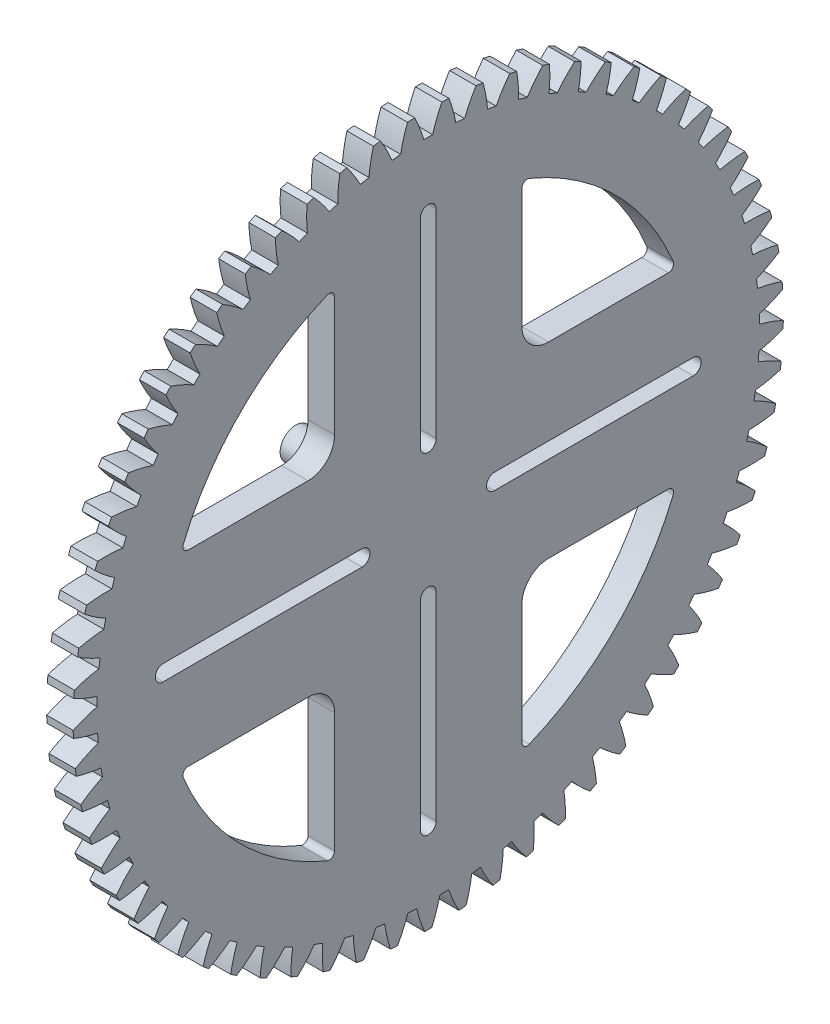
from build123d import *

# Parameters (mm, degrees)
BASPROSKE_W             = 10
BASPROSKE_H             = 134
TOOTHCUT_DEPTH          = 190.768279752
TEETHCUTS_COUNT         = 65
TEETHCUTS_ANGLE         = 354.461538462
HUBNEAONESKE_R          = 6
HUBNEARONE_DEPTH        = 40.0000508
BORSKE_R                = 4
BORE_DEPTH              = 50.0000508
ENL_V_MAT_EXTRU_1_DEPTH = 10
ENL_V_MAT_EXTRU_2_DEPTH = 5
CONG_1_R                = 10
CONG_2_R                = 2
ENL_V_MAT_EXTRU_3_DEPTH = 194.670907796
CONG_3_R                = 10
CONG_4_R                = 2
CONG_5_R                = 1
ESQUISSE5_R             = 11
ESQUISSE5_R_2           = 6
BOSS_EXTRU_1_DEPTH      = 17
CONG_6_SIZE             = 2
CONG_6_SIZE_2           = 10
BOSS_EXTRU_2_START      = -30
BOSS_EXTRU_2_DEPTH      = 30
BOSS_EXTRU_3_START      = 20.0000508
ESQUISSE7_R             = 4
BOSS_EXTRU_3_DEPTH      = 20.0000508
ENL_V_START             = -23
ESQUISSE8_R             = 6
ESQUISSE8_R_2           = 5.9
ENL_V_MAT_EXTRU_4_DEPTH = 23


with BuildPart() as part:
    # BasProSke → Base-Revolve (revolve)
    with BuildSketch(Plane(origin=(0, 0, 0), x_dir=(1, 0, 0), z_dir=(0, 1, 0)), mode=Mode.PRIVATE) as base_revolve_sk:
        with Locations((5, 67)):
            Rectangle(BASPROSKE_W, BASPROSKE_H)
    revolve(base_revolve_sk.sketch.rotate(Axis((-10, 0, 0), (1, 0, 0)), 180), axis=Axis((-10, 0, 0), (1, 0, 0)))

    # TooCutSke → ToothCut (cut, through all)
    with BuildSketch(Plane(origin=(0, 0, 0), x_dir=(0, 0, -1), z_dir=(1, 0, 0))):
        with BuildLine():
            ThreePointArc((1.667679112, 124.987874801), (0, 124.999), (-1.667679112, 124.987874801))
            ThreePointArc((-1.667679112, 124.987874801), (-3.198590853, 129.537570146), (-5.142534786, 133.926704511))
            ThreePointArc((-5.142534786, 133.926704511), (0, 134.0254), (5.142534786, 133.926704511))
            ThreePointArc((5.142534786, 133.926704511), (3.198590853, 129.537570146), (1.667679112, 124.987874801))
        make_face()
    toothcut = extrude(amount=TOOTHCUT_DEPTH, mode=Mode.SUBTRACT)

    # TeethCuts: ToothCut ×65 about axis
    teethcuts_axis = Axis((-10, 0, 0), (1, 0, 0))
    for i in range(1, TEETHCUTS_COUNT):
        add(toothcut.rotate(teethcuts_axis, i * TEETHCUTS_ANGLE / (TEETHCUTS_COUNT - 1)), mode=Mode.SUBTRACT)

    # HubNeaOneSke → HubNearOne (add)
    with BuildSketch(Plane.ZY):
        with Locations(Location((0, 0, 0), (0, 0, 180))):
            Circle(HUBNEAONESKE_R)
    extrude(amount=HUBNEARONE_DEPTH)

    # BorSke → Bore (cut, symmetric)
    with BuildSketch(Plane(origin=(0, 0, 0), x_dir=(0, 0, -1), z_dir=(1, 0, 0))):
        with Locations(Location((0, 0, 0), (0, 0, 180))):
            Circle(BORSKE_R)
    extrude(amount=BORE_DEPTH, both=True, mode=Mode.SUBTRACT)

    # Esquisse1 → Enlèv. mat.-Extru.1 (cut)
    with BuildSketch(Plane(origin=(10, 0, 0), x_dir=(0, 0, -1), z_dir=(1, 0, 0))):
        with BuildLine():
            Line((3, 100), (3, 25))
            Line((3, 25), (-3, 25))
            Line((-3, 25), (-3, 100))
            ThreePointArc((-3, 100), (0, 103), (3, 100))
        make_face()
        with BuildLine():
            Line((-3, 25), (3, 25))
            ThreePointArc((3, 25), (0, 22), (-3, 25))
        make_face()
        with BuildLine():
            Line((100, 3), (25, 3))
            ThreePointArc((25, 3), (22, 0), (25, -3))
            Line((25, -3), (100, -3))
            ThreePointArc((100, -3), (103, 0), (100, 3))
        make_face()
        with BuildLine():
            Line((-100, -3), (-25, -3))
            ThreePointArc((-25, -3), (-22, 0), (-25, 3))
            Line((-25, 3), (-100, 3))
            ThreePointArc((-100, 3), (-103, 0), (-100, -3))
        make_face()
        with BuildLine():
            Line((3, -100), (3, -25))
            ThreePointArc((3, -25), (0, -22), (-3, -25))
            Line((-3, -25), (-3, -100))
            ThreePointArc((-3, -100), (0, -103), (3, -100))
        make_face()
    extrude(amount=-ENL_V_MAT_EXTRU_1_DEPTH, mode=Mode.SUBTRACT)

    # Esquisse3 → Enlèv. mat.-Extru.2 (cut)
    with BuildSketch(Plane.ZY):
        Polygon((-113, -8), (-113, -18), (-18, -18), (-18, -113), (-8, -113), (-8, -12), (-12, -12), (-12, -8), align=None)
        Polygon((-113, 8), (-12, 8), (-12, 12), (-8, 12), (-8, 113), (-18, 113), (-18, 18), (-113, 18), align=None)
        Polygon((8, 113), (8, 12), (12, 12), (12, 8), (113, 8), (113, 18), (18, 18), (18, 113), align=None)
        Polygon((113, -8), (12, -8), (12, -12), (8, -12), (8, -113), (18, -113), (18, -18), (113, -18), align=None)
    extrude(amount=-ENL_V_MAT_EXTRU_2_DEPTH, mode=Mode.SUBTRACT)

    # Congé1
    # the kernel refuses this fillet: 10 mm, written as the material it takes off along each edge
    with BuildSketch(Plane(origin=(-25, -18, -18), x_dir=(0, 0, -1), z_dir=(1, 0, 0)), Plane(origin=(-25, 18, -18), x_dir=(0, 1, 0), z_dir=(1, 0, 0)), Plane(origin=(-25, 18, 18), x_dir=(0, 0, 1), z_dir=(1, 0, 0)), Plane(origin=(-25, -18, 18), x_dir=(0, -1, 0), z_dir=(1, 0, 0))) as cong_1_piece_1:
        with BuildLine():
            CenterArc((CONG_1_R, -CONG_1_R), CONG_1_R, 90, 90)
            Line((0, -CONG_1_R), (0, 0))
            Line((0, 0), (CONG_1_R, 0))
        make_face()
    extrude(amount=30, mode=Mode.SUBTRACT)
    with BuildSketch(Plane(origin=(-10, -12, 12), x_dir=(0, 1, 0), z_dir=(1, 0, 0)), Plane(origin=(-10, -12, -12), x_dir=(0, 0, 1), z_dir=(1, 0, 0)), Plane(origin=(-10, 12, 12), x_dir=(0, 0, -1), z_dir=(1, 0, 0)), Plane(origin=(-10, 12, -12), x_dir=(0, -1, 0), z_dir=(1, 0, 0))) as cong_1_piece_2:
        with BuildLine():
            CenterArc((8.782329983, -8.782329983), CONG_1_R, 118.570059811, 32.859880379)
            Line((0, -4), (0, 0))
            Line((0, 0), (4, 0))
        make_face()
    extrude(amount=15, mode=Mode.SUBTRACT)

    # Congé2
    cong_2_edges = [part.edges().sort_by_distance(p)[0] for p in [
        (2.5, 18, 113),
        (2.5, 8, 113),
        (2.5, 113, 8),
        (2.5, 113, 18),
        (2.5, 8, -113),
        (2.5, 18, -113),
        (2.5, 113, -18),
        (2.5, 113, -8),
        (2.5, -8, -113),
        (2.5, -113, -8),
        (2.5, -113, -18),
        (2.5, -18, -113),
        (2.5, -113, 18),
        (2.5, -113, 8),
        (2.5, -8, 113),
        (2.5, -18, 113),
    ]]
    fillet(cong_2_edges, radius=CONG_2_R)

    # Esquisse4 → Enlèv. mat.-Extru.3 (cut, through all)
    with BuildSketch(Plane.ZY):
        with BuildLine():
            Line((-93.541434669, 35.355339059), (-35.355339059, 35.355339059))
            Line((-35.355339059, 35.355339059), (-35.355339059, 93.541434669))
            ThreePointArc((-35.355339059, 93.541434669), (-70.710678119, 70.710678119), (-93.541434669, 35.355339059))
        make_face()
        with BuildLine():
            Line((35.355339059, 93.541434669), (35.355339059, 35.355339059))
            Line((35.355339059, 35.355339059), (93.541434669, 35.355339059))
            ThreePointArc((93.541434669, 35.355339059), (70.710678119, 70.710678119), (35.355339059, 93.541434669))
        make_face()
        with BuildLine():
            Line((93.541434669, -35.355339059), (35.355339059, -35.355339059))
            Line((35.355339059, -35.355339059), (35.355339059, -93.541434669))
            ThreePointArc((35.355339059, -93.541434669), (70.710678119, -70.710678119), (93.541434669, -35.355339059))
        make_face()
        with BuildLine():
            Line((-35.355339059, -93.541434669), (-35.355339059, -35.355339059))
            Line((-35.355339059, -35.355339059), (-93.541434669, -35.355339059))
            ThreePointArc((-93.541434669, -35.355339059), (-70.710678119, -70.710678119), (-35.355339059, -93.541434669))
        make_face()
    extrude(amount=-ENL_V_MAT_EXTRU_3_DEPTH, mode=Mode.SUBTRACT)

    # Congé3
    cong_3_edges = [part.edges().sort_by_distance(p)[0] for p in [
        (5, 35.355339059, -35.355339059),
        (5, 35.355339059, 35.355339059),
        (5, -35.355339059, 35.355339059),
        (5, -35.355339059, -35.355339059),
    ]]
    fillet(cong_3_edges, radius=CONG_3_R)

    # Congé4
    cong_4_edges = [part.edges().sort_by_distance(p)[0] for p in [
        (5, 35.355339059, -93.541434669),
        (5, 93.541434669, -35.355339059),
        (5, 93.541434669, 35.355339059),
        (5, 35.355339059, 93.541434669),
        (5, -35.355339059, 93.541434669),
        (5, -93.541434669, 35.355339059),
        (5, -93.541434669, -35.355339059),
        (5, -35.355339059, -93.541434669),
    ]]
    fillet(cong_4_edges, radius=CONG_4_R)

    # Congé5
    # the kernel refuses this fillet: 1 mm, written as the material it takes off along each edge
    with BuildSketch(Plane(origin=(0, 8, 9.5), x_dir=(0, -1, 0), z_dir=(0, 0, 1))) as cong_5_piece_1_section:
        with BuildLine():
            CenterArc((CONG_5_R, CONG_5_R), CONG_5_R, 180, 90)
            Line((0, CONG_5_R), (0, 0))
            Line((0, 0), (CONG_5_R, 0))
        make_face()
    cong_5_piece_1 = extrude(amount=101.5, mode=Mode.PRIVATE)
    cong_5_piece_1 = cong_5_piece_1 - Plane(origin=(0, 3.217670017, 3.217670017), x_dir=(0, 0, -1), z_dir=(-1, 0, 0)) * Cylinder(10, 208, mode=Mode.PRIVATE)
    with BuildSketch(Plane(origin=(0, 9.5, -8), x_dir=(0, 0, 1), z_dir=(0, 1, 0))) as cong_5_piece_2_section:
        with BuildLine():
            CenterArc((CONG_5_R, CONG_5_R), CONG_5_R, 180, 90)
            Line((0, CONG_5_R), (0, 0))
            Line((0, 0), (CONG_5_R, 0))
        make_face()
    cong_5_piece_2 = extrude(amount=101.5, mode=Mode.PRIVATE)
    cong_5_piece_2 = cong_5_piece_2 - Plane(origin=(0, 3.217670017, -3.217670017), x_dir=(0, -1, 0), z_dir=(-1, 0, 0)) * Cylinder(10, 207, mode=Mode.PRIVATE)
    with BuildSketch(Plane(origin=(0, -8, -9.5), x_dir=(0, 1, 0), z_dir=(0, 0, -1))) as cong_5_piece_3_section:
        with BuildLine():
            CenterArc((CONG_5_R, CONG_5_R), CONG_5_R, 180, 90)
            Line((0, CONG_5_R), (0, 0))
            Line((0, 0), (CONG_5_R, 0))
        make_face()
    cong_5_piece_3 = extrude(amount=101.5, mode=Mode.PRIVATE)
    cong_5_piece_3 = cong_5_piece_3 - Plane(origin=(0, -3.217670017, -3.217670017), x_dir=(0, 0, 1), z_dir=(-1, 0, 0)) * Cylinder(10, 207, mode=Mode.PRIVATE)
    with BuildSketch(Plane(origin=(0, -9.5, 8), x_dir=(0, 0, -1), z_dir=(0, -1, 0))) as cong_5_piece_4_section:
        with BuildLine():
            CenterArc((CONG_5_R, CONG_5_R), CONG_5_R, 180, 90)
            Line((0, CONG_5_R), (0, 0))
            Line((0, 0), (CONG_5_R, 0))
        make_face()
    cong_5_piece_4 = extrude(amount=101.5, mode=Mode.PRIVATE)
    cong_5_piece_4 = cong_5_piece_4 - Plane(origin=(0, -3.217670017, 3.217670017), x_dir=(0, 1, 0), z_dir=(-1, 0, 0)) * Cylinder(10, 207, mode=Mode.PRIVATE)
    with BuildSketch(Plane(origin=(0, -28, -18), x_dir=(0, 0, -1), z_dir=(0, -1, 0)), Plane(origin=(0, 18, -28), x_dir=(0, 1, 0), z_dir=(0, 0, -1)), Plane(origin=(0, -18, 28), x_dir=(0, -1, 0), z_dir=(0, 0, 1)), Plane(origin=(0, 28, 18), x_dir=(0, 0, 1), z_dir=(0, 1, 0)), Plane(origin=(0, 111, -18), x_dir=(0, 0, -1), z_dir=(0, -1, 0)), Plane(origin=(0, 18, 111), x_dir=(0, 1, 0), z_dir=(0, 0, -1)), Plane(origin=(0, -111, 18), x_dir=(0, 0, 1), z_dir=(0, 1, 0)), Plane(origin=(0, -18, -111), x_dir=(0, -1, 0), z_dir=(0, 0, 1))) as cong_5_piece_5:
        with BuildLine():
            CenterArc((CONG_5_R, CONG_5_R), CONG_5_R, 180, 90)
            Line((0, CONG_5_R), (0, 0))
            Line((0, 0), (CONG_5_R, 0))
        make_face()
    cong_5_piece_5_solid = extrude(amount=83, mode=Mode.PRIVATE)
    with BuildSketch(Plane(origin=(0, 3.217670017, -3.217670017), x_dir=(0, 0.9692508920434058, -0.24607459900010414), z_dir=(0, 0.24607459900010414, 0.9692508920434058))) as cong_5_piece_6_section:
        with BuildLine():
            CenterArc((10 - CONG_5_R, -CONG_5_R), CONG_5_R, 0, 90)
            Line((10, -CONG_5_R), (10, 0))
            Line((10, 0), (10 - CONG_5_R, 0))
        make_face()
    cong_5_piece_6 = revolve(axis=Axis((0, 3.217670017, -3.217670017), (-1, 0, 0)), revolution_arc=61.509303849, mode=Mode.PRIVATE)
    cong_5_piece_6 = split(cong_5_piece_6, bisect_by=Plane(origin=(0, 8, -3.217670017), z_dir=(0, 1, 0)), keep=Keep.TOP, mode=Mode.PRIVATE)
    cong_5_piece_6 = split(cong_5_piece_6, bisect_by=Plane(origin=(0, 3.217670017, -8), z_dir=(0, 0, -1)), keep=Keep.TOP, mode=Mode.PRIVATE)
    with BuildSketch(Plane(origin=(0, 3.217670017, 3.217670017), x_dir=(0, 0.24607459900010414, 0.9692508920434058), z_dir=(0, -0.9692508920434058, 0.24607459900010414))) as cong_5_piece_7_section:
        with BuildLine():
            CenterArc((10 - CONG_5_R, -CONG_5_R), CONG_5_R, 0, 90)
            Line((10, -CONG_5_R), (10, 0))
            Line((10, 0), (10 - CONG_5_R, 0))
        make_face()
    cong_5_piece_7 = revolve(axis=Axis((0, 3.217670017, 3.217670017), (-1, 0, 0)), revolution_arc=61.509303849, mode=Mode.PRIVATE)
    cong_5_piece_7 = split(cong_5_piece_7, bisect_by=Plane(origin=(0, 3.217670017, 8), z_dir=(0, 0, 1)), keep=Keep.TOP, mode=Mode.PRIVATE)
    cong_5_piece_7 = split(cong_5_piece_7, bisect_by=Plane(origin=(0, 8, 3.217670017), z_dir=(0, 1, 0)), keep=Keep.TOP, mode=Mode.PRIVATE)
    with BuildSketch(Plane(origin=(0, -3.217670017, -3.217670017), x_dir=(0, -0.24607459900010414, -0.9692508920434058), z_dir=(0, 0.9692508920434058, -0.24607459900010414))) as cong_5_piece_8_section:
        with BuildLine():
            CenterArc((10 - CONG_5_R, -CONG_5_R), CONG_5_R, 0, 90)
            Line((10, -CONG_5_R), (10, 0))
            Line((10, 0), (10 - CONG_5_R, 0))
        make_face()
    cong_5_piece_8 = revolve(axis=Axis((0, -3.217670017, -3.217670017), (-1, 0, 0)), revolution_arc=61.509303849, mode=Mode.PRIVATE)
    cong_5_piece_8 = split(cong_5_piece_8, bisect_by=Plane(origin=(0, -8, -3.217670017), z_dir=(0, -1, 0)), keep=Keep.TOP, mode=Mode.PRIVATE)
    cong_5_piece_8 = split(cong_5_piece_8, bisect_by=Plane(origin=(0, -3.217670017, -8), z_dir=(0, 0, -1)), keep=Keep.TOP, mode=Mode.PRIVATE)
    with BuildSketch(Plane(origin=(0, -3.217670017, 3.217670017), x_dir=(0, -0.9692508920434058, 0.24607459900010414), z_dir=(0, -0.24607459900010414, -0.9692508920434058))) as cong_5_piece_9_section:
        with BuildLine():
            CenterArc((10 - CONG_5_R, -CONG_5_R), CONG_5_R, 0, 90)
            Line((10, -CONG_5_R), (10, 0))
            Line((10, 0), (10 - CONG_5_R, 0))
        make_face()
    cong_5_piece_9 = revolve(axis=Axis((0, -3.217670017, 3.217670017), (-1, 0, 0)), revolution_arc=61.509303849, mode=Mode.PRIVATE)
    cong_5_piece_9 = split(cong_5_piece_9, bisect_by=Plane(origin=(0, -8, 3.217670017), z_dir=(0, -1, 0)), keep=Keep.TOP, mode=Mode.PRIVATE)
    cong_5_piece_9 = split(cong_5_piece_9, bisect_by=Plane(origin=(0, -3.217670017, 8), z_dir=(0, 0, 1)), keep=Keep.TOP, mode=Mode.PRIVATE)
    with BuildSketch(Plane(origin=(0, -28, 28), x_dir=(0, 1, 0), z_dir=(0, 0, 1))) as cong_5_piece_10:
        with BuildLine():
            CenterArc((10 - CONG_5_R, -CONG_5_R), CONG_5_R, 0, 90)
            Line((10, -CONG_5_R), (10, 0))
            Line((10, 0), (10 - CONG_5_R, 0))
        make_face()
    cong_5_piece_10_solid = revolve(axis=Axis((0, -28, 28), (-1, 0, 0)), revolution_arc=90, mode=Mode.PRIVATE)
    with BuildSketch(Plane(origin=(0, 28, 28), x_dir=(0, 0, -1), z_dir=(0, 1, 0))) as cong_5_piece_11:
        with BuildLine():
            CenterArc((10 - CONG_5_R, -CONG_5_R), CONG_5_R, 0, 90)
            Line((10, -CONG_5_R), (10, 0))
            Line((10, 0), (10 - CONG_5_R, 0))
        make_face()
    cong_5_piece_11_solid = revolve(axis=Axis((0, 28, 28), (-1, 0, 0)), revolution_arc=90, mode=Mode.PRIVATE)
    with BuildSketch(Plane(origin=(0, 28, -28), x_dir=(0, -1, 0), z_dir=(0, 0, -1))) as cong_5_piece_12:
        with BuildLine():
            CenterArc((10 - CONG_5_R, -CONG_5_R), CONG_5_R, 0, 90)
            Line((10, -CONG_5_R), (10, 0))
            Line((10, 0), (10 - CONG_5_R, 0))
        make_face()
    cong_5_piece_12_solid = revolve(axis=Axis((0, 28, -28), (-1, 0, 0)), revolution_arc=90, mode=Mode.PRIVATE)
    with BuildSketch(Plane(origin=(0, -28, -28), x_dir=(0, 0, 1), z_dir=(0, -1, 0))) as cong_5_piece_13:
        with BuildLine():
            CenterArc((10 - CONG_5_R, -CONG_5_R), CONG_5_R, 0, 90)
            Line((10, -CONG_5_R), (10, 0))
            Line((10, 0), (10 - CONG_5_R, 0))
        make_face()
    cong_5_piece_13_solid = revolve(axis=Axis((0, -28, -28), (-1, 0, 0)), revolution_arc=90, mode=Mode.PRIVATE)
    with BuildSketch(Plane(origin=(0, 113, -10), x_dir=(0, 1, 0), z_dir=(0, 0, -1)), Plane(origin=(0, 113, 16), x_dir=(0, 1, 0), z_dir=(0, 0, -1)), Plane(origin=(0, 10, 113), x_dir=(0, 0, 1), z_dir=(0, 1, 0)), Plane(origin=(0, -16, 113), x_dir=(0, 0, 1), z_dir=(0, 1, 0)), Plane(origin=(0, -113, 10), x_dir=(0, -1, 0), z_dir=(0, 0, 1)), Plane(origin=(0, -113, -16), x_dir=(0, -1, 0), z_dir=(0, 0, 1)), Plane(origin=(0, -10, -113), x_dir=(0, 0, -1), z_dir=(0, -1, 0)), Plane(origin=(0, 16, -113), x_dir=(0, 0, -1), z_dir=(0, -1, 0))) as cong_5_piece_14:
        with BuildLine():
            CenterArc((CONG_5_R, CONG_5_R), CONG_5_R, 180, 90)
            Line((0, CONG_5_R), (0, 0))
            Line((0, 0), (CONG_5_R, 0))
        make_face()
    cong_5_piece_14_solid = extrude(amount=6, mode=Mode.PRIVATE)
    with BuildSketch(Plane(origin=(0, 111, 8), x_dir=(0, 0, -1), z_dir=(0, -1, 0))) as cong_5_piece_15_section:
        with BuildLine():
            CenterArc((CONG_5_R, CONG_5_R), CONG_5_R, 180, 90)
            Line((0, CONG_5_R), (0, 0))
            Line((0, 0), (CONG_5_R, 0))
        make_face()
    cong_5_piece_15 = extrude(amount=101.5, mode=Mode.PRIVATE)
    cong_5_piece_15 = cong_5_piece_15 - Plane(origin=(0, 3.217670017, 3.217670017), x_dir=(0, 0, -1), z_dir=(-1, 0, 0)) * Cylinder(10, 207, mode=Mode.PRIVATE)
    with BuildSketch(Plane(origin=(0, -8, 111), x_dir=(0, 1, 0), z_dir=(0, 0, -1))) as cong_5_piece_16_section:
        with BuildLine():
            CenterArc((CONG_5_R, CONG_5_R), CONG_5_R, 180, 90)
            Line((0, CONG_5_R), (0, 0))
            Line((0, 0), (CONG_5_R, 0))
        make_face()
    cong_5_piece_16 = extrude(amount=101.5, mode=Mode.PRIVATE)
    cong_5_piece_16 = cong_5_piece_16 - Plane(origin=(0, -3.217670017, 3.217670017), x_dir=(0, 1, 0), z_dir=(-1, 0, 0)) * Cylinder(10, 207, mode=Mode.PRIVATE)
    with BuildSketch(Plane(origin=(0, -111, -8), x_dir=(0, 0, 1), z_dir=(0, 1, 0))) as cong_5_piece_17_section:
        with BuildLine():
            CenterArc((CONG_5_R, CONG_5_R), CONG_5_R, 180, 90)
            Line((0, CONG_5_R), (0, 0))
            Line((0, 0), (CONG_5_R, 0))
        make_face()
    cong_5_piece_17 = extrude(amount=101.5, mode=Mode.PRIVATE)
    cong_5_piece_17 = cong_5_piece_17 - Plane(origin=(0, -3.217670017, -3.217670017), x_dir=(0, 0, 1), z_dir=(-1, 0, 0)) * Cylinder(10, 207, mode=Mode.PRIVATE)
    with BuildSketch(Plane(origin=(0, 8, -111), x_dir=(0, -1, 0), z_dir=(0, 0, 1))) as cong_5_piece_18_section:
        with BuildLine():
            CenterArc((CONG_5_R, CONG_5_R), CONG_5_R, 180, 90)
            Line((0, CONG_5_R), (0, 0))
            Line((0, 0), (CONG_5_R, 0))
        make_face()
    cong_5_piece_18 = extrude(amount=101.5, mode=Mode.PRIVATE)
    cong_5_piece_18 = cong_5_piece_18 - Plane(origin=(0, 3.217670017, -3.217670017), x_dir=(0, -1, 0), z_dir=(-1, 0, 0)) * Cylinder(10, 207, mode=Mode.PRIVATE)
    with BuildSketch(Plane(origin=(0, 111, -16), x_dir=(0, 1, 0), z_dir=(0, 0, 1))) as cong_5_piece_19:
        with BuildLine():
            CenterArc((2 + CONG_5_R, -CONG_5_R), CONG_5_R, 90, 90)
            Line((2, -CONG_5_R), (2, 0))
            Line((2, 0), (2 + CONG_5_R, 0))
        make_face()
    cong_5_piece_19_solid = revolve(axis=Axis((0, 111, -16), (-1, 0, 0)), revolution_arc=90, mode=Mode.PRIVATE)
    with BuildSketch(Plane(origin=(0, 111, -10), x_dir=(0, 0, 1), z_dir=(0, -1, 0))) as cong_5_piece_20:
        with BuildLine():
            CenterArc((2 + CONG_5_R, -CONG_5_R), CONG_5_R, 90, 90)
            Line((2, -CONG_5_R), (2, 0))
            Line((2, 0), (2 + CONG_5_R, 0))
        make_face()
    cong_5_piece_20_solid = revolve(axis=Axis((0, 111, -10), (-1, 0, 0)), revolution_arc=90, mode=Mode.PRIVATE)
    with BuildSketch(Plane(origin=(0, 111, 10), x_dir=(0, 0, -1), z_dir=(0, -1, 0))) as cong_5_piece_21:
        with BuildLine():
            CenterArc((2 + CONG_5_R, CONG_5_R), CONG_5_R, 180, 90)
            Line((2, CONG_5_R), (2, 0))
            Line((2, 0), (2 + CONG_5_R, 0))
        make_face()
    cong_5_piece_21_solid = revolve(axis=Axis((0, 111, 10), (1, 0, 0)), revolution_arc=90, mode=Mode.PRIVATE)
    with BuildSketch(Plane(origin=(0, 111, 16), x_dir=(0, 0, 1), z_dir=(0, -1, 0))) as cong_5_piece_22:
        with BuildLine():
            CenterArc((2 + CONG_5_R, -CONG_5_R), CONG_5_R, 90, 90)
            Line((2, -CONG_5_R), (2, 0))
            Line((2, 0), (2 + CONG_5_R, 0))
        make_face()
    cong_5_piece_22_solid = revolve(axis=Axis((0, 111, 16), (-1, 0, 0)), revolution_arc=90, mode=Mode.PRIVATE)
    with BuildSketch(Plane(origin=(0, 16, 111), x_dir=(0, 0, 1), z_dir=(0, -1, 0))) as cong_5_piece_23:
        with BuildLine():
            CenterArc((2 + CONG_5_R, -CONG_5_R), CONG_5_R, 90, 90)
            Line((2, -CONG_5_R), (2, 0))
            Line((2, 0), (2 + CONG_5_R, 0))
        make_face()
    cong_5_piece_23_solid = revolve(axis=Axis((0, 16, 111), (-1, 0, 0)), revolution_arc=90, mode=Mode.PRIVATE)
    with BuildSketch(Plane(origin=(0, 10, 111), x_dir=(0, -1, 0), z_dir=(0, 0, -1))) as cong_5_piece_24:
        with BuildLine():
            CenterArc((2 + CONG_5_R, -CONG_5_R), CONG_5_R, 90, 90)
            Line((2, -CONG_5_R), (2, 0))
            Line((2, 0), (2 + CONG_5_R, 0))
        make_face()
    cong_5_piece_24_solid = revolve(axis=Axis((0, 10, 111), (-1, 0, 0)), revolution_arc=90, mode=Mode.PRIVATE)
    with BuildSketch(Plane(origin=(0, -10, 111), x_dir=(0, 1, 0), z_dir=(0, 0, -1))) as cong_5_piece_25:
        with BuildLine():
            CenterArc((2 + CONG_5_R, CONG_5_R), CONG_5_R, 180, 90)
            Line((2, CONG_5_R), (2, 0))
            Line((2, 0), (2 + CONG_5_R, 0))
        make_face()
    cong_5_piece_25_solid = revolve(axis=Axis((0, -10, 111), (1, 0, 0)), revolution_arc=90, mode=Mode.PRIVATE)
    with BuildSketch(Plane(origin=(0, -16, 111), x_dir=(0, -1, 0), z_dir=(0, 0, -1))) as cong_5_piece_26:
        with BuildLine():
            CenterArc((2 + CONG_5_R, -CONG_5_R), CONG_5_R, 90, 90)
            Line((2, -CONG_5_R), (2, 0))
            Line((2, 0), (2 + CONG_5_R, 0))
        make_face()
    cong_5_piece_26_solid = revolve(axis=Axis((0, -16, 111), (-1, 0, 0)), revolution_arc=90, mode=Mode.PRIVATE)
    with BuildSketch(Plane(origin=(0, -111, 16), x_dir=(0, -1, 0), z_dir=(0, 0, -1))) as cong_5_piece_27:
        with BuildLine():
            CenterArc((2 + CONG_5_R, -CONG_5_R), CONG_5_R, 90, 90)
            Line((2, -CONG_5_R), (2, 0))
            Line((2, 0), (2 + CONG_5_R, 0))
        make_face()
    cong_5_piece_27_solid = revolve(axis=Axis((0, -111, 16), (-1, 0, 0)), revolution_arc=90, mode=Mode.PRIVATE)
    with BuildSketch(Plane(origin=(0, -111, 10), x_dir=(0, 0, -1), z_dir=(0, 1, 0))) as cong_5_piece_28:
        with BuildLine():
            CenterArc((2 + CONG_5_R, -CONG_5_R), CONG_5_R, 90, 90)
            Line((2, -CONG_5_R), (2, 0))
            Line((2, 0), (2 + CONG_5_R, 0))
        make_face()
    cong_5_piece_28_solid = revolve(axis=Axis((0, -111, 10), (-1, 0, 0)), revolution_arc=90, mode=Mode.PRIVATE)
    with BuildSketch(Plane(origin=(0, -111, -10), x_dir=(0, -1, 0), z_dir=(0, 0, -1))) as cong_5_piece_29:
        with BuildLine():
            CenterArc((2 + CONG_5_R, -CONG_5_R), CONG_5_R, 90, 90)
            Line((2, -CONG_5_R), (2, 0))
            Line((2, 0), (2 + CONG_5_R, 0))
        make_face()
    cong_5_piece_29_solid = revolve(axis=Axis((0, -111, -10), (-1, 0, 0)), revolution_arc=90, mode=Mode.PRIVATE)
    with BuildSketch(Plane(origin=(0, -111, -16), x_dir=(0, 0, -1), z_dir=(0, 1, 0))) as cong_5_piece_30:
        with BuildLine():
            CenterArc((2 + CONG_5_R, -CONG_5_R), CONG_5_R, 90, 90)
            Line((2, -CONG_5_R), (2, 0))
            Line((2, 0), (2 + CONG_5_R, 0))
        make_face()
    cong_5_piece_30_solid = revolve(axis=Axis((0, -111, -16), (-1, 0, 0)), revolution_arc=90, mode=Mode.PRIVATE)
    with BuildSketch(Plane(origin=(0, -16, -111), x_dir=(0, 0, -1), z_dir=(0, 1, 0))) as cong_5_piece_31:
        with BuildLine():
            CenterArc((2 + CONG_5_R, -CONG_5_R), CONG_5_R, 90, 90)
            Line((2, -CONG_5_R), (2, 0))
            Line((2, 0), (2 + CONG_5_R, 0))
        make_face()
    cong_5_piece_31_solid = revolve(axis=Axis((0, -16, -111), (-1, 0, 0)), revolution_arc=90, mode=Mode.PRIVATE)
    with BuildSketch(Plane(origin=(0, -10, -111), x_dir=(0, 0, -1), z_dir=(0, -1, 0))) as cong_5_piece_32:
        with BuildLine():
            CenterArc((2 + CONG_5_R, CONG_5_R), CONG_5_R, 180, 90)
            Line((2, CONG_5_R), (2, 0))
            Line((2, 0), (2 + CONG_5_R, 0))
        make_face()
    cong_5_piece_32_solid = revolve(axis=Axis((0, -10, -111), (1, 0, 0)), revolution_arc=90, mode=Mode.PRIVATE)
    with BuildSketch(Plane(origin=(0, 10, -111), x_dir=(0, -1, 0), z_dir=(0, 0, 1))) as cong_5_piece_33:
        with BuildLine():
            CenterArc((2 + CONG_5_R, CONG_5_R), CONG_5_R, 180, 90)
            Line((2, CONG_5_R), (2, 0))
            Line((2, 0), (2 + CONG_5_R, 0))
        make_face()
    cong_5_piece_33_solid = revolve(axis=Axis((0, 10, -111), (1, 0, 0)), revolution_arc=90, mode=Mode.PRIVATE)
    with BuildSketch(Plane(origin=(0, 16, -111), x_dir=(0, 1, 0), z_dir=(0, 0, 1))) as cong_5_piece_34:
        with BuildLine():
            CenterArc((2 + CONG_5_R, -CONG_5_R), CONG_5_R, 90, 90)
            Line((2, -CONG_5_R), (2, 0))
            Line((2, 0), (2 + CONG_5_R, 0))
        make_face()
    cong_5_piece_34_solid = revolve(axis=Axis((0, 16, -111), (-1, 0, 0)), revolution_arc=90, mode=Mode.PRIVATE)
    with BuildSketch(Plane(origin=(0, 3.217670017, 3.217670017), x_dir=(0, 0.24607459900010414, 0.9692508920434058), z_dir=(0, -0.9692508920434058, 0.24607459900010414))) as cong_5_piece_35a_section:
        with BuildLine():
            CenterArc((10 - CONG_5_R, -CONG_5_R), CONG_5_R, 0, 90)
            Line((10, -CONG_5_R), (10, 0))
            Line((10, 0), (10 - CONG_5_R, 0))
        make_face()
    cong_5_piece_35a = revolve(axis=Axis((0, 3.217670017, 3.217670017), (-1, 0, 0)), revolution_arc=61.509303849, mode=Mode.PRIVATE)
    cong_5_piece_35a = split(cong_5_piece_35a, bisect_by=Plane(origin=(0, 8, 3.217670017), z_dir=(0, -1, 0)), keep=Keep.TOP, mode=Mode.PRIVATE)
    with BuildSketch(Plane(origin=(0, 8, 9.5), x_dir=(0, -1, 0), z_dir=(0, 0, 1))) as cong_5_piece_35b_section:
        with BuildLine():
            CenterArc((CONG_5_R, CONG_5_R), CONG_5_R, 180, 90)
            Line((0, CONG_5_R), (0, 0))
            Line((0, 0), (CONG_5_R, 0))
        make_face()
    cong_5_piece_35b = extrude(amount=101.5, mode=Mode.PRIVATE)
    cong_5_piece_35b = cong_5_piece_35b & Plane(origin=(0, 3.217670017, 3.217670017), x_dir=(0, 0, -1), z_dir=(-1, 0, 0)) * Cylinder(10, 208, mode=Mode.PRIVATE)
    cong_5_piece_35 = cong_5_piece_35a & cong_5_piece_35b
    with BuildSketch(Plane(origin=(0, 3.217670017, -3.217670017), x_dir=(0, 0.9692508920434058, -0.24607459900010414), z_dir=(0, 0.24607459900010414, 0.9692508920434058))) as cong_5_piece_36a_section:
        with BuildLine():
            CenterArc((10 - CONG_5_R, -CONG_5_R), CONG_5_R, 0, 90)
            Line((10, -CONG_5_R), (10, 0))
            Line((10, 0), (10 - CONG_5_R, 0))
        make_face()
    cong_5_piece_36a = revolve(axis=Axis((0, 3.217670017, -3.217670017), (-1, 0, 0)), revolution_arc=61.509303849, mode=Mode.PRIVATE)
    cong_5_piece_36a = split(cong_5_piece_36a, bisect_by=Plane(origin=(0, 3.217670017, -8), z_dir=(0, 0, 1)), keep=Keep.TOP, mode=Mode.PRIVATE)
    with BuildSketch(Plane(origin=(0, 9.5, -8), x_dir=(0, 0, 1), z_dir=(0, 1, 0))) as cong_5_piece_36b_section:
        with BuildLine():
            CenterArc((CONG_5_R, CONG_5_R), CONG_5_R, 180, 90)
            Line((0, CONG_5_R), (0, 0))
            Line((0, 0), (CONG_5_R, 0))
        make_face()
    cong_5_piece_36b = extrude(amount=101.5, mode=Mode.PRIVATE)
    cong_5_piece_36b = cong_5_piece_36b & Plane(origin=(0, 3.217670017, -3.217670017), x_dir=(0, -1, 0), z_dir=(-1, 0, 0)) * Cylinder(10, 207, mode=Mode.PRIVATE)
    cong_5_piece_36 = cong_5_piece_36a & cong_5_piece_36b
    with BuildSketch(Plane(origin=(0, -8, -9.5), x_dir=(0, 1, 0), z_dir=(0, 0, -1))) as cong_5_piece_37a_section:
        with BuildLine():
            CenterArc((CONG_5_R, CONG_5_R), CONG_5_R, 180, 90)
            Line((0, CONG_5_R), (0, 0))
            Line((0, 0), (CONG_5_R, 0))
        make_face()
    cong_5_piece_37a = extrude(amount=101.5, mode=Mode.PRIVATE)
    cong_5_piece_37a = cong_5_piece_37a & Plane(origin=(0, -3.217670017, -3.217670017), x_dir=(0, 0, 1), z_dir=(-1, 0, 0)) * Cylinder(10, 207, mode=Mode.PRIVATE)
    with BuildSketch(Plane(origin=(0, -3.217670017, -3.217670017), x_dir=(0, -0.24607459900010414, -0.9692508920434058), z_dir=(0, 0.9692508920434058, -0.24607459900010414))) as cong_5_piece_37b_section:
        with BuildLine():
            CenterArc((10 - CONG_5_R, -CONG_5_R), CONG_5_R, 0, 90)
            Line((10, -CONG_5_R), (10, 0))
            Line((10, 0), (10 - CONG_5_R, 0))
        make_face()
    cong_5_piece_37b = revolve(axis=Axis((0, -3.217670017, -3.217670017), (-1, 0, 0)), revolution_arc=61.509303849, mode=Mode.PRIVATE)
    cong_5_piece_37b = split(cong_5_piece_37b, bisect_by=Plane(origin=(0, -8, -3.217670017), z_dir=(0, 1, 0)), keep=Keep.TOP, mode=Mode.PRIVATE)
    cong_5_piece_37 = cong_5_piece_37a & cong_5_piece_37b
    with BuildSketch(Plane(origin=(0, -3.217670017, 3.217670017), x_dir=(0, -0.9692508920434058, 0.24607459900010414), z_dir=(0, -0.24607459900010414, -0.9692508920434058))) as cong_5_piece_38a_section:
        with BuildLine():
            CenterArc((10 - CONG_5_R, -CONG_5_R), CONG_5_R, 0, 90)
            Line((10, -CONG_5_R), (10, 0))
            Line((10, 0), (10 - CONG_5_R, 0))
        make_face()
    cong_5_piece_38a = revolve(axis=Axis((0, -3.217670017, 3.217670017), (-1, 0, 0)), revolution_arc=61.509303849, mode=Mode.PRIVATE)
    cong_5_piece_38a = split(cong_5_piece_38a, bisect_by=Plane(origin=(0, -3.217670017, 8), z_dir=(0, 0, -1)), keep=Keep.TOP, mode=Mode.PRIVATE)
    with BuildSketch(Plane(origin=(0, -9.5, 8), x_dir=(0, 0, -1), z_dir=(0, -1, 0))) as cong_5_piece_38b_section:
        with BuildLine():
            CenterArc((CONG_5_R, CONG_5_R), CONG_5_R, 180, 90)
            Line((0, CONG_5_R), (0, 0))
            Line((0, 0), (CONG_5_R, 0))
        make_face()
    cong_5_piece_38b = extrude(amount=101.5, mode=Mode.PRIVATE)
    cong_5_piece_38b = cong_5_piece_38b & Plane(origin=(0, -3.217670017, 3.217670017), x_dir=(0, 1, 0), z_dir=(-1, 0, 0)) * Cylinder(10, 207, mode=Mode.PRIVATE)
    cong_5_piece_38 = cong_5_piece_38a & cong_5_piece_38b
    with BuildSketch(Plane(origin=(0, 8, -111), x_dir=(0, -1, 0), z_dir=(0, 0, 1))) as cong_5_piece_39a_section:
        with BuildLine():
            CenterArc((CONG_5_R, CONG_5_R), CONG_5_R, 180, 90)
            Line((0, CONG_5_R), (0, 0))
            Line((0, 0), (CONG_5_R, 0))
        make_face()
    cong_5_piece_39a = extrude(amount=101.5, mode=Mode.PRIVATE)
    cong_5_piece_39a = cong_5_piece_39a & Plane(origin=(0, 3.217670017, -3.217670017), x_dir=(0, -1, 0), z_dir=(-1, 0, 0)) * Cylinder(10, 207, mode=Mode.PRIVATE)
    with BuildSketch(Plane(origin=(0, 3.217670017, -3.217670017), x_dir=(0, 0.9692508920434058, -0.24607459900010414), z_dir=(0, 0.24607459900010414, 0.9692508920434058))) as cong_5_piece_39b_section:
        with BuildLine():
            CenterArc((10 - CONG_5_R, -CONG_5_R), CONG_5_R, 0, 90)
            Line((10, -CONG_5_R), (10, 0))
            Line((10, 0), (10 - CONG_5_R, 0))
        make_face()
    cong_5_piece_39b = revolve(axis=Axis((0, 3.217670017, -3.217670017), (-1, 0, 0)), revolution_arc=61.509303849, mode=Mode.PRIVATE)
    cong_5_piece_39b = split(cong_5_piece_39b, bisect_by=Plane(origin=(0, 8, -3.217670017), z_dir=(0, -1, 0)), keep=Keep.TOP, mode=Mode.PRIVATE)
    cong_5_piece_39 = cong_5_piece_39a & cong_5_piece_39b
    with BuildSketch(Plane(origin=(0, 111, 8), x_dir=(0, 0, -1), z_dir=(0, -1, 0))) as cong_5_piece_40a_section:
        with BuildLine():
            CenterArc((CONG_5_R, CONG_5_R), CONG_5_R, 180, 90)
            Line((0, CONG_5_R), (0, 0))
            Line((0, 0), (CONG_5_R, 0))
        make_face()
    cong_5_piece_40a = extrude(amount=101.5, mode=Mode.PRIVATE)
    cong_5_piece_40a = cong_5_piece_40a & Plane(origin=(0, 3.217670017, 3.217670017), x_dir=(0, 0, -1), z_dir=(-1, 0, 0)) * Cylinder(10, 207, mode=Mode.PRIVATE)
    with BuildSketch(Plane(origin=(0, 3.217670017, 3.217670017), x_dir=(0, 0.24607459900010414, 0.9692508920434058), z_dir=(0, -0.9692508920434058, 0.24607459900010414))) as cong_5_piece_40b_section:
        with BuildLine():
            CenterArc((10 - CONG_5_R, -CONG_5_R), CONG_5_R, 0, 90)
            Line((10, -CONG_5_R), (10, 0))
            Line((10, 0), (10 - CONG_5_R, 0))
        make_face()
    cong_5_piece_40b = revolve(axis=Axis((0, 3.217670017, 3.217670017), (-1, 0, 0)), revolution_arc=61.509303849, mode=Mode.PRIVATE)
    cong_5_piece_40b = split(cong_5_piece_40b, bisect_by=Plane(origin=(0, 3.217670017, 8), z_dir=(0, 0, -1)), keep=Keep.TOP, mode=Mode.PRIVATE)
    cong_5_piece_40 = cong_5_piece_40a & cong_5_piece_40b
    with BuildSketch(Plane(origin=(0, -3.217670017, -3.217670017), x_dir=(0, -0.24607459900010414, -0.9692508920434058), z_dir=(0, 0.9692508920434058, -0.24607459900010414))) as cong_5_piece_41a_section:
        with BuildLine():
            CenterArc((10 - CONG_5_R, -CONG_5_R), CONG_5_R, 0, 90)
            Line((10, -CONG_5_R), (10, 0))
            Line((10, 0), (10 - CONG_5_R, 0))
        make_face()
    cong_5_piece_41a = revolve(axis=Axis((0, -3.217670017, -3.217670017), (-1, 0, 0)), revolution_arc=61.509303849, mode=Mode.PRIVATE)
    cong_5_piece_41a = split(cong_5_piece_41a, bisect_by=Plane(origin=(0, -3.217670017, -8), z_dir=(0, 0, 1)), keep=Keep.TOP, mode=Mode.PRIVATE)
    with BuildSketch(Plane(origin=(0, -111, -8), x_dir=(0, 0, 1), z_dir=(0, 1, 0))) as cong_5_piece_41b_section:
        with BuildLine():
            CenterArc((CONG_5_R, CONG_5_R), CONG_5_R, 180, 90)
            Line((0, CONG_5_R), (0, 0))
            Line((0, 0), (CONG_5_R, 0))
        make_face()
    cong_5_piece_41b = extrude(amount=101.5, mode=Mode.PRIVATE)
    cong_5_piece_41b = cong_5_piece_41b & Plane(origin=(0, -3.217670017, -3.217670017), x_dir=(0, 0, 1), z_dir=(-1, 0, 0)) * Cylinder(10, 207, mode=Mode.PRIVATE)
    cong_5_piece_41 = cong_5_piece_41a & cong_5_piece_41b
    with BuildSketch(Plane(origin=(0, -8, 111), x_dir=(0, 1, 0), z_dir=(0, 0, -1))) as cong_5_piece_42a_section:
        with BuildLine():
            CenterArc((CONG_5_R, CONG_5_R), CONG_5_R, 180, 90)
            Line((0, CONG_5_R), (0, 0))
            Line((0, 0), (CONG_5_R, 0))
        make_face()
    cong_5_piece_42a = extrude(amount=101.5, mode=Mode.PRIVATE)
    cong_5_piece_42a = cong_5_piece_42a & Plane(origin=(0, -3.217670017, 3.217670017), x_dir=(0, 1, 0), z_dir=(-1, 0, 0)) * Cylinder(10, 207, mode=Mode.PRIVATE)
    with BuildSketch(Plane(origin=(0, -3.217670017, 3.217670017), x_dir=(0, -0.9692508920434058, 0.24607459900010414), z_dir=(0, -0.24607459900010414, -0.9692508920434058))) as cong_5_piece_42b_section:
        with BuildLine():
            CenterArc((10 - CONG_5_R, -CONG_5_R), CONG_5_R, 0, 90)
            Line((10, -CONG_5_R), (10, 0))
            Line((10, 0), (10 - CONG_5_R, 0))
        make_face()
    cong_5_piece_42b = revolve(axis=Axis((0, -3.217670017, 3.217670017), (-1, 0, 0)), revolution_arc=61.509303849, mode=Mode.PRIVATE)
    cong_5_piece_42b = split(cong_5_piece_42b, bisect_by=Plane(origin=(0, -8, 3.217670017), z_dir=(0, 1, 0)), keep=Keep.TOP, mode=Mode.PRIVATE)
    cong_5_piece_42 = cong_5_piece_42a & cong_5_piece_42b
    add([cong_5_piece_1, cong_5_piece_2, cong_5_piece_3, cong_5_piece_4, cong_5_piece_5_solid, cong_5_piece_6, cong_5_piece_7, cong_5_piece_8, cong_5_piece_9, cong_5_piece_10_solid, cong_5_piece_11_solid, cong_5_piece_12_solid, cong_5_piece_13_solid, cong_5_piece_14_solid, cong_5_piece_15, cong_5_piece_16, cong_5_piece_17, cong_5_piece_18, cong_5_piece_19_solid, cong_5_piece_20_solid, cong_5_piece_21_solid, cong_5_piece_22_solid, cong_5_piece_23_solid, cong_5_piece_24_solid, cong_5_piece_25_solid, cong_5_piece_26_solid, cong_5_piece_27_solid, cong_5_piece_28_solid, cong_5_piece_29_solid, cong_5_piece_30_solid, cong_5_piece_31_solid, cong_5_piece_32_solid, cong_5_piece_33_solid, cong_5_piece_34_solid, cong_5_piece_35, cong_5_piece_36, cong_5_piece_37, cong_5_piece_38, cong_5_piece_39, cong_5_piece_40, cong_5_piece_41, cong_5_piece_42], mode=Mode.SUBTRACT)

    # Esquisse5 → Boss.-Extru.1 (add)
    with BuildSketch(Plane.ZY):
        with Locations(Location((0, 0, 0), (0, 0, 180))):
            Circle(ESQUISSE5_R)
        Circle(ESQUISSE5_R_2, mode=Mode.SUBTRACT)
    extrude(amount=BOSS_EXTRU_1_DEPTH)

    # Congé6
    # a fillet whose section is not a circle: 10, 2 mm, written as the material it adds along each edge
    with BuildSketch(Plane(origin=(0, 0, 0), x_dir=(0, 0, -1), z_dir=(0, 1, 0))) as cong_6_piece_1:
        with BuildLine():
            Bezier((11 + CONG_6_SIZE, 0), (11, 0), (11, CONG_6_SIZE_2), weights=[1, 0.707106781, 1])
            Line((11, CONG_6_SIZE_2), (11, 0))
            Line((11, 0), (11 + CONG_6_SIZE, 0))
        make_face()
    revolve(axis=Axis((0, 0, 0), (-1, 0, 0)))

    # Esquisse6 → Boss.-Extru.2 (add)
    with BuildSketch(Plane.ZY.offset(40.0000508).offset(BOSS_EXTRU_2_START)):
        with BuildLine():
            ThreePointArc((2.645751311, 3), (0, 4), (-2.645751311, 3))
            Line((-2.645751311, 3), (2.645751311, 3))
        make_face()
    extrude(amount=BOSS_EXTRU_2_DEPTH)

    # Esquisse7 → Boss.-Extru.3 (add)
    with BuildSketch(Plane(origin=(-10.0000508, 0, 0), x_dir=(0, 0, -1), z_dir=(1, 0, 0)).offset(BOSS_EXTRU_3_START)):
        Circle(ESQUISSE7_R)
    extrude(amount=-BOSS_EXTRU_3_DEPTH)

    # Esquisse8 → Enlèv. mat.-Extru.4 (cut)
    with BuildSketch(Plane.ZY.offset(40.0000508).offset(ENL_V_START)):
        Circle(ESQUISSE8_R)
        Circle(ESQUISSE8_R_2, mode=Mode.SUBTRACT)
    extrude(amount=ENL_V_MAT_EXTRU_4_DEPTH, mode=Mode.SUBTRACT)


solid = part.part
